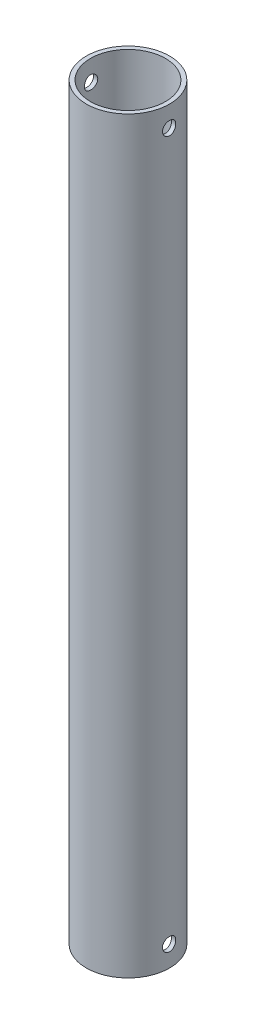
from build123d import *

# Parameters (mm, degrees)
SKETCH1_R            = 10
SKETCH1_R_2          = 9
BOSS_EXTRUDE1_DEPTH  = 179.7
M3_CLEARANCE_HOLE1_D = 3.2


with BuildPart() as part:
    # Sketch1 → Boss-Extrude1 (new body)
    with BuildSketch(Plane(origin=(0, 0, 0), x_dir=(1, 0, 0), z_dir=(0, 1, 0))):
        Circle(SKETCH1_R)
        Circle(SKETCH1_R_2, mode=Mode.SUBTRACT)
    extrude(amount=BOSS_EXTRUDE1_DEPTH)

    # M3 Clearance Hole1 (through all)
    with Locations(Plane.ZY.offset(10)):
        with Locations((0, 5)):
            m3_clearance_hole1 = Hole(M3_CLEARANCE_HOLE1_D / 2)

    # Mirror1: M3 Clearance Hole1 across plane
    add(m3_clearance_hole1.mirror(Plane.ZX.offset(89.85)), mode=Mode.SUBTRACT)


solid = part.part
